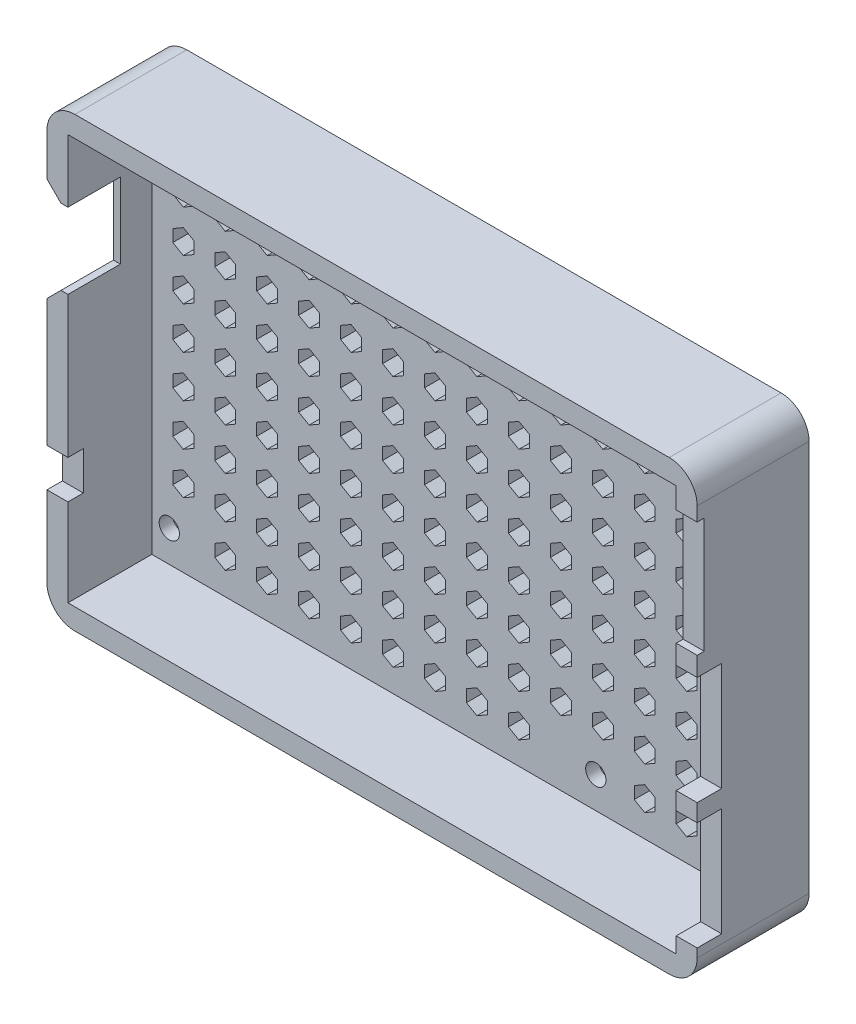
from build123d import *

# Parameters (mm, degrees)
BASE_SKETCH_W                      = 93
BASE_SKETCH_H                      = 64
BASE_DEPTH                         = 16
INSIDE_CUT_SKETCH_W                = 87
INSIDE_CUT_SKETCH_H                = 58
INSIDE_CUT_DEPTH                   = 12
FRONT_CONNECTORS_REACH             = 101.644
FRONT_CONNECTORS_SKETCH_W          = 1
FRONT_CONNECTORS_SKETCH_H          = 16.5
FRONT_CONNECTORS_SKETCH_W_2        = 3.5
FRONT_CONNECTORS_SKETCH_H_2        = 15.5
BACK_CONNECTORS_REACH              = 101.644
BACK_CONNECTORS_SKETCH_W           = 7.5
BACK_CONNECTORS_SKETCH_H           = 10.8
BACK_CONNECTORS_SKETCH_W_2         = 2.2
BACK_CONNECTORS_SKETCH_H_2         = 5.5
MOLEX_ANGLE_SIZE                   = 2
SCREW_HOLES_D                      = 2.9
SCREW_HOLES_CBORE_D                = 6
SCREW_HOLES_CBORE_DEPTH            = 2.1
BOX_ROUNDING_R                     = 4
VENTILATION_HOLE_DEPTH             = 10
VENTILATION_HOLES_ARRAY_COUNT      = 14
VENTILATION_HOLES_ARRAY_PITCH      = 6
VENTILATION_HOLES_ARRAY_COUNT_DIR2 = 9
VENTILATION_HOLES_ARRAY_PITCH_DIR2 = 6


with BuildPart() as part:
    # Base sketch → Base (new body)
    with BuildSketch(Plane.XY):
        Rectangle(BASE_SKETCH_W, BASE_SKETCH_H)
    extrude(amount=BASE_DEPTH)

    # Inside cut sketch → Inside cut (cut)
    with BuildSketch(Plane.XY.offset(16)):
        Rectangle(INSIDE_CUT_SKETCH_W, INSIDE_CUT_SKETCH_H)
    extrude(amount=-INSIDE_CUT_DEPTH, mode=Mode.SUBTRACT)

    # Front connectors sketch → Front connectors (cut, up to next)
    with BuildSketch(Plane(origin=(46.5, 0, 0), x_dir=(0, 0, -1), z_dir=(1, 0, 0)), mode=Mode.PRIVATE) as front_connectors_sk1:
        with Locations((-15.5, 17.75)):
            Rectangle(FRONT_CONNECTORS_SKETCH_W, FRONT_CONNECTORS_SKETCH_H)
    front_connectors_tool1 = extrude(front_connectors_sk1.sketch, amount=-FRONT_CONNECTORS_REACH, mode=Mode.PRIVATE) & part.part
    # Front connectors sketch → Front connectors (cut, up to next)
    with BuildSketch(Plane(origin=(46.5, 0, 0), x_dir=(0, 0, -1), z_dir=(1, 0, 0)), mode=Mode.PRIVATE) as front_connectors_sk2:
        with Locations((-14.25, -1)):
            Rectangle(FRONT_CONNECTORS_SKETCH_W_2, FRONT_CONNECTORS_SKETCH_H_2)
    front_connectors_tool2 = extrude(front_connectors_sk2.sketch, amount=-FRONT_CONNECTORS_REACH, mode=Mode.PRIVATE) & part.part
    # Front connectors sketch → Front connectors (cut, up to next)
    with BuildSketch(Plane(origin=(46.5, 0, 0), x_dir=(0, 0, -1), z_dir=(1, 0, 0)), mode=Mode.PRIVATE) as front_connectors_sk3:
        with Locations((-14.25, -19)):
            Rectangle(FRONT_CONNECTORS_SKETCH_W_2, FRONT_CONNECTORS_SKETCH_H_2)
    front_connectors_tool3 = extrude(front_connectors_sk3.sketch, amount=-FRONT_CONNECTORS_REACH, mode=Mode.PRIVATE) & part.part
    add(front_connectors_tool1.solids().sort_by_distance((46.5, 17.75, 15.5))[0], mode=Mode.SUBTRACT)
    add(front_connectors_tool2.solids().sort_by_distance((46.5, -1, 14.25))[0], mode=Mode.SUBTRACT)
    add(front_connectors_tool3.solids().sort_by_distance((46.5, -19, 14.25))[0], mode=Mode.SUBTRACT)

    # Back connectors sketch → Back connectors (cut, up to next)
    with BuildSketch(Plane.ZY.offset(46.5), mode=Mode.PRIVATE) as back_connectors_sk1:
        with Locations((12.25, 14.6)):
            Rectangle(BACK_CONNECTORS_SKETCH_W, BACK_CONNECTORS_SKETCH_H)
    back_connectors_tool1 = extrude(back_connectors_sk1.sketch, amount=-BACK_CONNECTORS_REACH, mode=Mode.PRIVATE) & part.part
    # Back connectors sketch → Back connectors (cut, up to next)
    with BuildSketch(Plane.ZY.offset(46.5), mode=Mode.PRIVATE) as back_connectors_sk2:
        with Locations((14.9, -13.75)):
            Rectangle(BACK_CONNECTORS_SKETCH_W_2, BACK_CONNECTORS_SKETCH_H_2)
    back_connectors_tool2 = extrude(back_connectors_sk2.sketch, amount=-BACK_CONNECTORS_REACH, mode=Mode.PRIVATE) & part.part
    add(back_connectors_tool1.solids().sort_by_distance((-46.5, 14.6, 12.25))[0], mode=Mode.SUBTRACT)
    add(back_connectors_tool2.solids().sort_by_distance((-46.5, -13.75, 14.9))[0], mode=Mode.SUBTRACT)

    # Molex angle
    molex_angle_edges = [part.edges().sort_by_distance(p)[0] for p in [
        (-46.5, 9.2, 12.25),
        (-46.5, 20, 12.25),
        (-46.5, 14.6, 8.5),
    ]]
    chamfer(molex_angle_edges, length=MOLEX_ANGLE_SIZE)

    # Screw holes (through all)
    with Locations(Plane(origin=(0, 0, 0), x_dir=(-1, 0, 0), z_dir=(0, 0, -1))):
        with Locations((-20, -24.5), (-20, 24.5), (41, 24.5), (41, -24.5)):
            CounterBoreHole(SCREW_HOLES_D / 2, SCREW_HOLES_CBORE_D / 2, SCREW_HOLES_CBORE_DEPTH)

    # Box rounding
    box_rounding_edges = [part.edges().sort_by_distance(p)[0] for p in [
        (-46.5, -32, 8),
        (-46.5, 32, 8),
        (46.5, 32, 8),
        (46.5, -32, 8),
    ]]
    fillet(box_rounding_edges, radius=BOX_ROUNDING_R)

    # Ventilation holes sketch → Ventilation hole (cut)
    with BuildSketch(Plane(origin=(0, 0, 0), x_dir=(-1, 0, 0), z_dir=(0, 0, -1))):
        Polygon((-39, 22.265898385), (-37.5, 23.131923789), (-37.5, 24.863974596), (-39, 25.73), (-40.5, 24.863974596), (-40.5, 23.131923789), align=None)
    ventilation_hole = extrude(amount=-VENTILATION_HOLE_DEPTH, mode=Mode.SUBTRACT)

    # Ventilation holes array: Ventilation hole 14 × 9, 6 skipped
    with Locations(*[(-i * VENTILATION_HOLES_ARRAY_PITCH, -j * VENTILATION_HOLES_ARRAY_PITCH_DIR2, 0) for i in range(VENTILATION_HOLES_ARRAY_COUNT) for j in range(VENTILATION_HOLES_ARRAY_COUNT_DIR2) if (i, j) not in ((0, 0), (3, 0), (3, 8), (4, 0), (4, 8), (13, 0), (13, 8))]):
        add(ventilation_hole, mode=Mode.SUBTRACT)


solid = part.part
